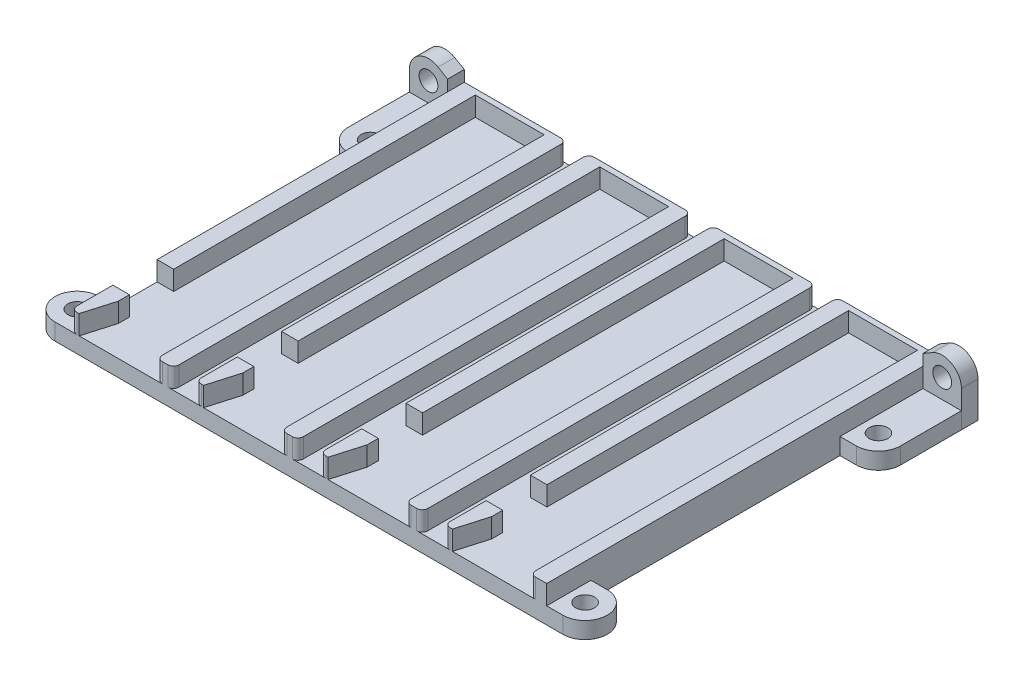
from build123d import *

# Parameters (mm, degrees)
SKETCH_2_R      = 1.7
EXTRUDE_1_DEPTH = 3
EXTRUDE_2_DEPTH = 3.5
FILLET_7_R      = 1
SKETCH_6_R      = 1.7
EXTRUDE_3_DEPTH = 3


with BuildPart() as part:
    # ｽｹｯﾁ2 → ﾎﾞｽ - 押し出し1 (new body)
    with BuildSketch(Plane(origin=(0, 0, 0), x_dir=(1, 0, 0), z_dir=(0, 1, 0))):
        with BuildLine():
            Line((0, 0), (85.95, 0))
            Line((85.95, 0), (88.895, 0))
            ThreePointArc((88.895, 0), (92.895, 4), (88.895, 8))
            Line((88.895, 8), (85.95, 8))
            Line((85.95, 8), (85.95, 53.05))
            Line((85.95, 53.05), (88.895, 53.05))
            ThreePointArc((88.895, 53.05), (91.723427125, 54.221572875), (92.895, 57.05))
            Line((92.895, 57.05), (92.895, 68.05))
            Line((92.895, 68.05), (85.95, 68.05))
            Line((85.95, 68.05), (85.95, 71.05))
            Line((85.95, 71.05), (0, 71.05))
            Line((0, 71.05), (0, 68.05))
            Line((0, 68.05), (-6.945, 68.05))
            Line((-6.945, 68.05), (-6.945, 57.05))
            ThreePointArc((-6.945, 57.05), (-5.773427125, 54.221572875), (-2.945, 53.05))
            Line((-2.945, 53.05), (0, 53.05))
            Line((0, 53.05), (0, 8))
            Line((0, 8), (-2.945, 8))
            ThreePointArc((-2.945, 8), (-6.945, 4), (-2.945, 0))
            Line((-2.945, 0), (0, 0))
        make_face()
        with Locations((88.895, 4)):
            Circle(SKETCH_2_R, mode=Mode.SUBTRACT)
        with Locations((-2.945, 4)):
            Circle(SKETCH_2_R, mode=Mode.SUBTRACT)
        with Locations((88.895, 57.05)):
            Circle(SKETCH_2_R, mode=Mode.SUBTRACT)
        with Locations((-2.945, 57.05)):
            Circle(SKETCH_2_R, mode=Mode.SUBTRACT)
    extrude(amount=EXTRUDE_1_DEPTH)

    # ｽｹｯﾁ3 → ﾎﾞｽ - 押し出し2 (add)
    with BuildSketch(Plane(origin=(0, 3, 0), x_dir=(1, 0, 0), z_dir=(0, 1, 0))):
        Polygon((68.9, 0), (70.5, 5.5), (70.5, 7.5), (67.5, 7.5), (67.5, 0), align=None)
        Polygon((67.5, 15.5), (70.5, 15.5), (70.5, 70.05), (82.95, 70.05), (82.95, 0), (85.95, 0), (85.95, 71.05), (67.5, 71.05), align=None)
        Polygon((45, 15.5), (48, 15.5), (48, 70.05), (60.45, 70.05), (60.45, 0), (63.45, 0), (63.45, 71.05), (45, 71.05), align=None)
        Polygon((46.4, 0), (48, 5.5), (48, 7.5), (45, 7.5), (45, 0), align=None)
        Polygon((22.5, 15.5), (25.5, 15.5), (25.5, 70.05), (37.95, 70.05), (37.95, 0), (40.95, 0), (40.95, 71.05), (22.5, 71.05), align=None)
        Polygon((23.9, 0), (25.5, 5.5), (25.5, 7.5), (22.5, 7.5), (22.5, 0), align=None)
        Polygon((0, 15.5), (3, 15.5), (3, 70.05), (15.45, 70.05), (15.45, 0), (18.45, 0), (18.45, 71.05), (0, 71.05), align=None)
        Polygon((1.4, 0), (3, 5.5), (3, 7.5), (0, 7.5), (0, 0), align=None)
    extrude(amount=EXTRUDE_2_DEPTH)

    # ﾌｨﾚｯﾄ7
    fillet_7_edges = [part.edges().sort_by_distance(p)[0] for p in [
        (67.5, 4.75, 0),
        (67.5, 4.75, -71.05),
        (63.45, 4.75, -71.05),
        (45, 4.75, -71.05),
        (40.95, 4.75, -71.05),
        (22.5, 4.75, -71.05),
        (18.45, 4.75, -71.05),
        (63.45, 4.75, 0),
        (60.45, 4.75, 0),
        (45, 4.75, 0),
        (40.95, 4.75, 0),
        (37.95, 4.75, 0),
        (22.5, 4.75, 0),
        (18.45, 4.75, 0),
        (15.45, 4.75, 0),
        (82.95, 4.75, 0),
        (0, 4.75, 0),
    ]]
    fillet(fillet_7_edges, radius=FILLET_7_R)

    # ｽｹｯﾁ6 → ﾎﾞｽ - 押し出し3 (add)
    # profile 1 of 2: a face of its own
    with BuildSketch(Plane(origin=(0, 0, -71.05), x_dir=(-1, 0, 0), z_dir=(0, 0, -1))):
        with BuildLine():
            Line((-85.95, 0), (-92.9, 0))
            Line((-92.9, 0), (-92.9, 6.5))
            ThreePointArc((-92.9, 6.5), (-91.158408298, 9.511796918), (-87.679326231, 9.504704327))
            Line((-87.679326231, 9.504704327), (-85.95, 8.5))
            Line((-85.95, 8.5), (-85.95, 6.5))
            Line((-85.95, 6.5), (-85.95, 0))
        make_face()
        with Locations((-89.425, 6.5)):
            Circle(SKETCH_6_R, mode=Mode.SUBTRACT)
    # profile 2 of 2: a face of its own
    with BuildSketch(Plane(origin=(0, 0, -71.05), x_dir=(-1, 0, 0), z_dir=(0, 0, -1))):
        with BuildLine():
            Line((0, 0), (0, 6.5))
            Line((0, 6.5), (0, 8.5))
            Line((0, 8.5), (1.729326231, 9.504704327))
            ThreePointArc((1.729326231, 9.504704327), (5.208408298, 9.511796918), (6.95, 6.5))
            Line((6.95, 6.5), (6.95, 0))
            Line((6.95, 0), (0, 0))
        make_face()
        with Locations((3.475, 6.5)):
            Circle(SKETCH_6_R, mode=Mode.SUBTRACT)
    extrude(amount=-EXTRUDE_3_DEPTH)


solid = part.part
